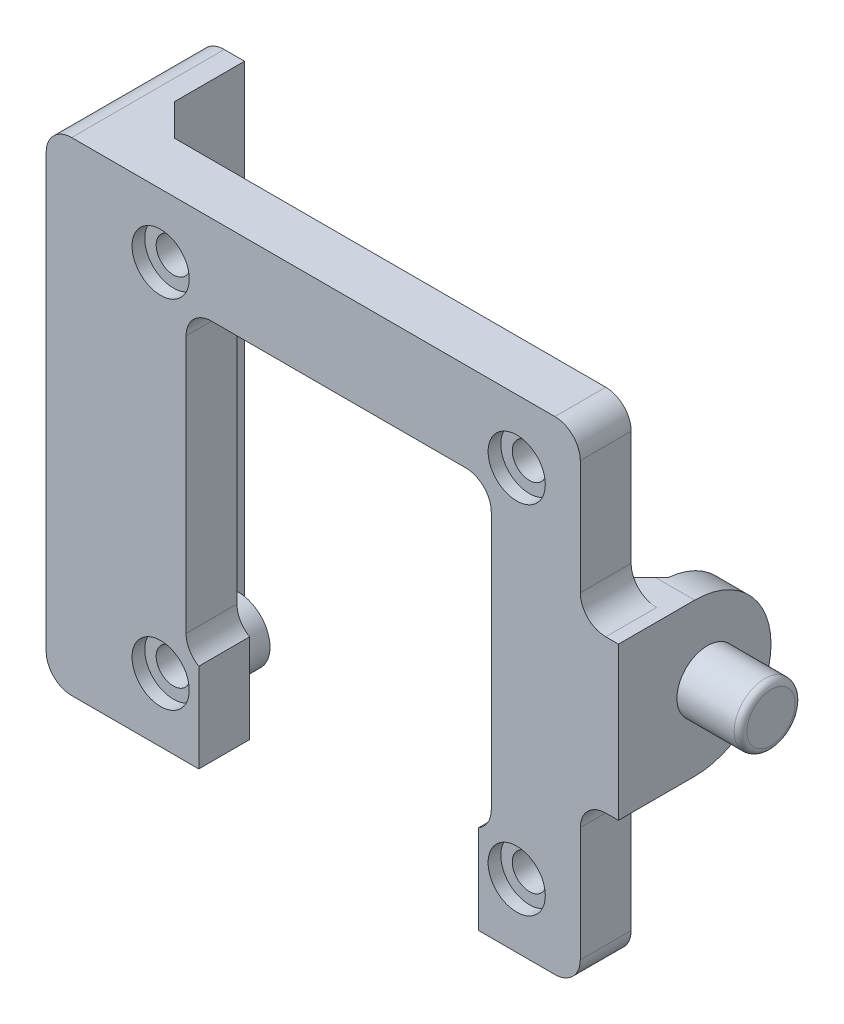
from build123d import *

# Parameters (mm, degrees)
EXTRUDE_1_DEPTH           = 4
EXTRUDE_START             = -4
SKETCH_6_R                = 2.5000000000000004
SKETCH_6_R_2              = 2.4999999999999987
EXTRUDE_5_DEPTH           = 2.1
HOLE_WIZARD_1_D           = 2.7
HOLE_WIZARD_1_CBORE_D     = 4.5
HOLE_WIZARD_1_CBORE_DEPTH = 1
EXTRUDE_3_DEPTH           = 4
FILLET_1_R                = 2
CUT_EXTRUDE_1_DEPTH       = 2
SKETCH_14_R               = 3.150000000000003
CUT_EXTRUDE_4_DEPTH       = 0.8
EXTRUDE_6_DEPTH           = 3
SKETCH_11_R               = 2.399999999999999
EXTRUDE_7_DEPTH           = 5
FILLET_2_RADIUS           = 6
FILLET_2_LENGTH           = 3
FILLET_4_R                = 2
FILLET_6_R                = 0.5
CUT_EXTRUDE_2_DEPTH       = 0.4
CUT_EXTRUDE_3_DEPTH       = 0.4
CHAMFER_1_SIZE            = 2.5


with BuildPart() as part:
    # 草图1 → 凸台-拉伸1 (new body)
    with BuildSketch(Plane.XY):
        Polygon((19, -19), (11.999999999999977, -19), (11.000000000000004, -19), (11.000000000000002, -11.999999999999998), (11.999999999999977, -11.999999999999973), (11.999999999999977, 12.000000000000027), (-12.000000000000023, 12.000000000000023), (-12.000000000000023, -11.999999999999977), (-10.999999999999996, -12.000000000000002), (-10.999999999999996, -19), (-11.999999999999996, -19), (-19, -19), (-19, 19), (19, 19), align=None)
    extrude(amount=-EXTRUDE_1_DEPTH)

    # 草图6 → 凸台-拉伸5 (add)
    with BuildSketch(Plane.XY.offset(EXTRUDE_START)):
        with Locations((-14.000000000000115, 14.000000000000014)):
            Circle(SKETCH_6_R)
        with Locations((-14.000000000000112, -13.999999999999996)):
            Circle(SKETCH_6_R)
        with Locations((14.0000000000001, -13.99999999999998)):
            Circle(SKETCH_6_R_2)
        with Locations((14.000000000000096, 14.00000000000002)):
            Circle(SKETCH_6_R_2)
    extrude(amount=-EXTRUDE_5_DEPTH)

    # 孔1 (through all)
    with Locations(Plane.XY):
        with Locations((-14, 14), (14, -14), (14, 14), (-14, -14), (0, 0), (0.008296822, -0.048065229)):
            CounterBoreHole(HOLE_WIZARD_1_D / 2, HOLE_WIZARD_1_CBORE_D / 2, HOLE_WIZARD_1_CBORE_DEPTH)

    # 草图5 → 凸台-拉伸3 (add)
    with BuildSketch(Plane.ZY.offset(19)):
        Polygon((-12.000000000000004, -19.000000000000007), (-4.47e-15, -19.000000000000004), (-3.7e-16, 18.999999999999996), (-12.000000000000004, 18.999999999999993), align=None)
    extrude(amount=EXTRUDE_3_DEPTH)

    # 圆角1
    # the kernel refuses this fillet: 2 mm, written as the material it adds along each edge
    with BuildSketch(Plane(origin=(11.999999999999977, 12.000000000000027, 0), x_dir=(-1, 0, 0), z_dir=(0, 0, -1)), Plane(origin=(-12.000000000000023, 12.000000000000023, 0), x_dir=(0, -1, 0), z_dir=(0, 0, -1))) as fillet_1_piece_1:
        with BuildLine():
            CenterArc((FILLET_1_R, -FILLET_1_R), FILLET_1_R, 90, 90)
            Line((0, -FILLET_1_R), (0, 0))
            Line((0, 0), (FILLET_1_R, 0))
        make_face()
    extrude(amount=4)
    with BuildSketch(Plane(origin=(11.999999999999977, -11.999999999999973, 0), x_dir=(0, 1, 0), z_dir=(0, 0, -1))) as fillet_1_piece_2:
        with BuildLine():
            CenterArc((1.7320508075689318, -2), FILLET_1_R, 90, 60.00000000000051)
            Line((4.619e-14, -1.000000000000016), (0, 0))
            Line((0, 0), (1.7320508075689318, 0))
        make_face()
    extrude(amount=4)
    with BuildSketch(Plane(origin=(-12.000000000000023, -11.999999999999977, 0), x_dir=(1, 4.796e-14, 0), z_dir=(0, 0, -1))) as fillet_1_piece_3:
        with BuildLine():
            CenterArc((2.000000000000083, -1.7320508075688679), FILLET_1_R, 120.00000000000053, 60.00000000000222)
            Line((8.307e-14, -1.7320508075689638), (0, 0))
            Line((0, 0), (1.0000000000000675, 0))
        make_face()
    extrude(amount=4)
    # the kernel refuses this fillet: 2 mm, written as the material it takes off along each edge
    with BuildSketch(Plane(origin=(19, -19, 5), x_dir=(-1, 0, 0), z_dir=(0, 0, -1)), Plane(origin=(19, 19, 5), x_dir=(0, -1, 0), z_dir=(0, 0, -1))) as fillet_1_2_piece_1:
        with BuildLine():
            CenterArc((FILLET_1_R, FILLET_1_R), FILLET_1_R, 180, 90)
            Line((0, FILLET_1_R), (0, 0))
            Line((0, 0), (FILLET_1_R, 0))
        make_face()
    extrude(amount=14, mode=Mode.SUBTRACT)
    with BuildSketch(Plane(origin=(-23, -19.000000000000007, -17.000000000000004), x_dir=(1, 3.55e-15, 0), z_dir=(0, 3e-16, 1))) as fillet_1_2_piece_2:
        with BuildLine():
            CenterArc((FILLET_1_R, FILLET_1_R), FILLET_1_R, 180, 89.99999999999977)
            Line((7.11e-15, FILLET_1_R), (0, 0))
            Line((0, 0), (FILLET_1_R, 0))
        make_face()
    extrude(amount=22, mode=Mode.SUBTRACT)
    with BuildSketch(Plane(origin=(-23, 18.999999999999996, 5), x_dir=(1, 3.55e-15, 0), z_dir=(0, -3e-16, -1))) as fillet_1_2_piece_3:
        with BuildLine():
            CenterArc((FILLET_1_R, FILLET_1_R), FILLET_1_R, 180, 90.00000000000023)
            Line((-7.11e-15, FILLET_1_R), (0, 0))
            Line((0, 0), (FILLET_1_R, 0))
        make_face()
    extrude(amount=22.000000000000004, mode=Mode.SUBTRACT)

    # 草图9 → 切除-拉伸1 (cut)
    with BuildSketch(Plane(origin=(-23, 0, -24), x_dir=(0, 0, -1), z_dir=(1, 0, 0))):
        with BuildLine():
            Line((-19.497620553954647, -15.010679125349048), (-20.147001897982854, -0.1374010702007968))
            ThreePointArc((-20.147001897982854, -0.1374010702007968), (-16.999999999999996, 3.149999999999999), (-13.852998102017144, -0.13740107020079845))
            Line((-13.852998102017144, -0.13740107020079845), (-14.50237944604535, -15.01067912534905))
            ThreePointArc((-14.50237944604535, -15.01067912534905), (-16.999999999999993, -17.401630656935822), (-19.497620553954647, -15.010679125349048))
        make_face()
    cut_extrude_1 = extrude(amount=CUT_EXTRUDE_1_DEPTH, mode=Mode.SUBTRACT)

    # 镜向2: 切除-拉伸1 across plane
    add(cut_extrude_1.mirror(Plane.ZX), mode=Mode.SUBTRACT)

    # 草图14 → 切除-拉伸4 (cut)
    with BuildSketch(Plane.ZY.offset(20.999999999999996)):
        with Locations((-7.000000000000003, -6.1e-16)):
            Circle(SKETCH_14_R)
    extrude(amount=-CUT_EXTRUDE_4_DEPTH, mode=Mode.SUBTRACT)

    # 草图10 → 凸台-拉伸6 (add)
    with BuildSketch(Plane(origin=(19, 0, 0), x_dir=(0, 0, -1), z_dir=(1, 0, 0))):
        Polygon((1.59e-15, 6), (12.000000000000002, 6.000000000000002), (12.000000000000002, -6.000000000000002), (1.59e-15, -6), align=None)
    extrude(amount=EXTRUDE_6_DEPTH)

    # 草图11 → 凸台-拉伸7 (add)
    with BuildSketch(Plane(origin=(22, 0, 0), x_dir=(0, 0, -1), z_dir=(1, 0, 0))):
        with Locations((7.000000000000001, 0)):
            Circle(SKETCH_11_R)
    extrude(amount=EXTRUDE_7_DEPTH)

    # 圆角2: full round fillet: the end face becomes a half cylinder, R = half its width
    fillet_2_face = Plane((20.5, 0, -12), x_dir=(-1, 0, 0), z_dir=(0, 0, -1))  # on the end face: x along it, z out of the body
    fillet_2_slab = fillet_2_face.offset(-FILLET_2_RADIUS / 2) * Box(FILLET_2_LENGTH, 2 * FILLET_2_RADIUS, FILLET_2_RADIUS, mode=Mode.PRIVATE)  # the body's end, R deep
    fillet_2_round = Plane((20.5, 0, -6), x_dir=(0, 0, -1), z_dir=(-1, 0, 0)) * Cylinder(FILLET_2_RADIUS, FILLET_2_LENGTH, mode=Mode.PRIVATE)  # its axis R under the face
    add(fillet_2_slab - fillet_2_round, mode=Mode.SUBTRACT)

    # 圆角4
    fillet_4_edges = [part.edges().sort_by_distance(p)[0] for p in [
        (19, -6, -2.0000000000000018),
        (19, 6, -2.000000000000001),
    ]]
    fillet(fillet_4_edges, radius=FILLET_4_R)

    # 圆角6
    fillet_6_edges = [part.edges().sort_by_distance(p)[0] for p in [
        (27, 2.9e-16, -4.600000000000001),
    ]]
    fillet(fillet_6_edges, radius=FILLET_6_R)

    # 草图12 → 切除-拉伸2 (cut)
    with BuildSketch(Plane.ZY.offset(-19)):
        with BuildLine():
            Line((-4, 6.000000000000001), (-5.999999999999998, 6.000000000000001))
            ThreePointArc((-5.999999999999998, 6.000000000000001), (-12, 7.3e-16), (-6, -6.000000000000001))
            Line((-6, -6.000000000000001), (-4, -6.000000000000001))
            Line((-4, -6.000000000000001), (-4, 6.000000000000001))
        make_face()
    extrude(amount=-CUT_EXTRUDE_2_DEPTH, mode=Mode.SUBTRACT)

    # 草图13 → 切除-拉伸3 (cut)
    with BuildSketch(Plane(origin=(-19, 0, 0), x_dir=(0, 0, -1), z_dir=(1, 0, 0))):
        Polygon((12.000000000000004, -19.000000000000007), (12.000000000000004, 18.999999999999993), (4, 19), (4, -19.000000000000004), align=None)
    extrude(amount=-CUT_EXTRUDE_3_DEPTH, mode=Mode.SUBTRACT)

    # 倒角1
    chamfer_1_edges = [part.edges().sort_by_distance(p)[0] for p in [
        (-19.4, 0, -4),
        (19.4, 0, -4),
    ]]
    chamfer(chamfer_1_edges, length=CHAMFER_1_SIZE)


solid = part.part
